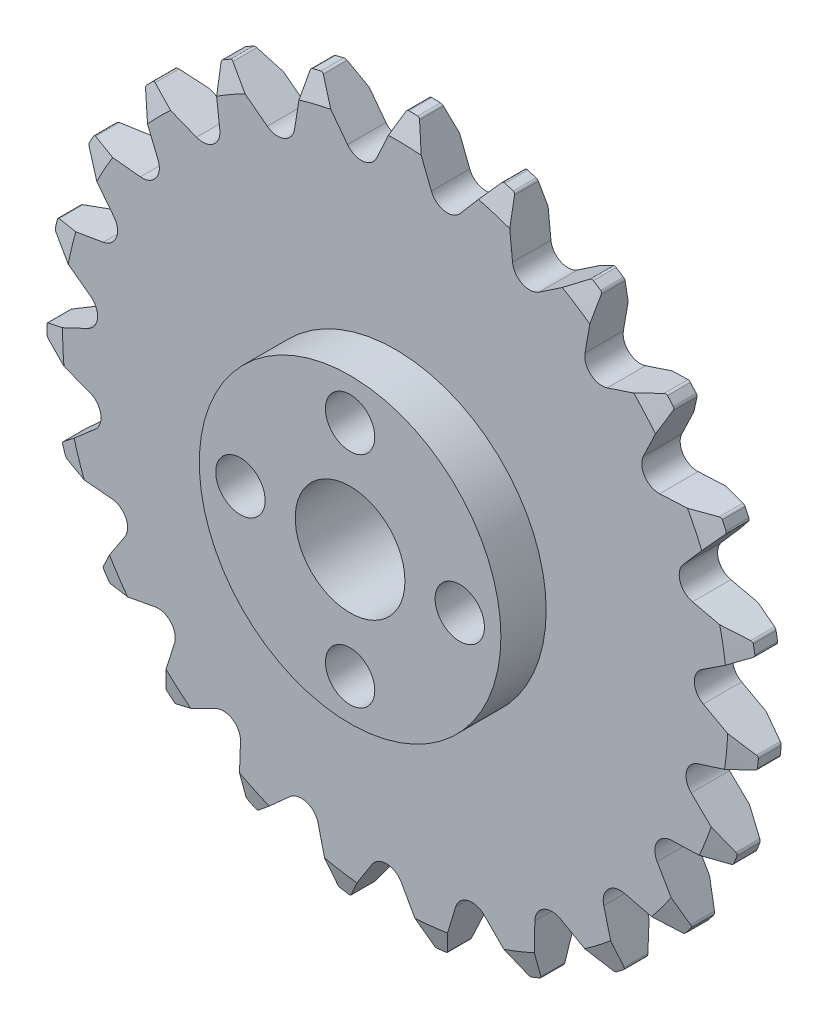
from build123d import *

# Parameters (mm, degrees)
SKETCH1_W                  = 26
SKETCH1_H                  = 2.7999944
CUT_EXTRUDE1_DEPTH         = 37.876008036
CUT_EXTRUDE2_DEPTH         = 37.876008036
CUT_EXTRUDE3_DEPTH         = 37.876008036
CUT_EXTRUDE4_DEPTH         = 37.876008036
CUT_EXTRUDE5_DEPTH         = 37.876008036
CUT_EXTRUDE6_DEPTH         = 37.876008036
CUT_EXTRUDE7_DEPTH         = 37.876008036
CUT_EXTRUDE8_DEPTH         = 37.876008036
CUT_EXTRUDE9_DEPTH         = 37.876008036
CUT_EXTRUDE10_DEPTH        = 37.876008036
CUT_EXTRUDE11_DEPTH        = 37.876008036
CUT_EXTRUDE12_DEPTH        = 37.876008036
CUT_EXTRUDE13_DEPTH        = 37.876008036
CUT_EXTRUDE14_DEPTH        = 37.876008036
CUT_EXTRUDE15_DEPTH        = 37.876008036
CUT_EXTRUDE16_DEPTH        = 37.871323245
CUT_EXTRUDE17_DEPTH        = 37.871323245
CUT_EXTRUDE18_DEPTH        = 37.871323245
CUT_EXTRUDE19_DEPTH        = 37.871323245
CUT_EXTRUDE20_DEPTH        = 37.871323245
CUT_EXTRUDE21_DEPTH        = 37.871323245
CUT_EXTRUDE22_DEPTH        = 37.870167928
CUT_EXTRUDE23_DEPTH        = 37.870167928
SKETCH25_W                 = 11
SKETCH25_H                 = 3.302
F_8_0_8_DIAMETER_HOLE1_D   = 8
F_3_6_3_6_DIAMETER_HOLE1_D = 3.6
F_3_6_3_6_DIAMETER_HOLE2_D = 3.6
FILLET1_R                  = 0.2


with BuildPart() as part:
    # Sketch1 → Revolve1 (revolve)
    with BuildSketch(Plane(origin=(0, 0, 0), x_dir=(1, 0, 0), z_dir=(0, 1, 0))):
        with Locations((13, 1.3999972)):
            Rectangle(SKETCH1_W, SKETCH1_H)
    revolve(axis=Axis((0, 0, -2.7999944), (0, 0, 1)))

    # Sketch2 → Cut-Extrude1 (cut, through all)
    with BuildSketch(Plane(origin=(0, 0, -2.7999944), x_dir=(-1, 0, 0), z_dir=(0, 0, -1))):
        with BuildLine():
            Line((18.801313039, 17.958580902), (17.308486788, 14.31139503))
            ThreePointArc((17.308486788, 14.31139503), (17.465043178, 13.088273063), (18.595024492, 12.594634046))
            Line((18.595024492, 12.594634046), (22.514630462, 13.003515492))
            ThreePointArc((22.514630462, 13.003515492), (20.80600791, 15.591986238), (18.801313039, 17.958580902))
        make_face()
    extrude(amount=-CUT_EXTRUDE1_DEPTH, mode=Mode.SUBTRACT)

    # Sketch3 → Cut-Extrude2 (cut, through all)
    with BuildSketch(Plane(origin=(0, 0, -2.7999944), x_dir=(-1, 0, 0), z_dir=(0, 0, -1))):
        with BuildLine():
            Line((22.949276492, 12.220094456), (20.527809316, 9.110915831))
            ThreePointArc((20.527809316, 9.110915831), (20.348565813, 7.890912137), (21.303462141, 7.110713283))
            Line((21.303462141, 7.110713283), (25.188033384, 6.446935261))
            ThreePointArc((25.188033384, 6.446935261), (24.24113224, 9.400399338), (22.949276492, 12.220094456))
        make_face()
    extrude(amount=-CUT_EXTRUDE2_DEPTH, mode=Mode.SUBTRACT)

    # Sketch4 → Cut-Extrude3 (cut, through all)
    with BuildSketch(Plane(origin=(0, 0, -2.7999944), x_dir=(-1, 0, 0), z_dir=(0, 0, -1))):
        with BuildLine():
            Line((25.395197093, 5.575299507), (22.224678136, 3.234721685))
            ThreePointArc((22.224678136, 3.234721685), (21.72292841, 2.108318355), (22.431919461, 1.099423446))
            Line((22.431919461, 1.099423446), (25.993355097, -0.587784666))
            ThreePointArc((25.993355097, -0.587784666), (25.878402688, 2.511627823), (25.395197093, 5.575299507))
        make_face()
    extrude(amount=-CUT_EXTRUDE3_DEPTH, mode=Mode.SUBTRACT)

    # Sketch5 → Cut-Extrude4 (cut, through all)
    with BuildSketch(Plane(origin=(0, 0, -2.7999944), x_dir=(-1, 0, 0), z_dir=(0, 0, -1))):
        with BuildLine():
            Line((25.957672102, -1.482989902), (22.273244249, -2.881376971))
            ThreePointArc((22.273244249, -2.881376971), (21.486200783, -3.830639754), (21.896703933, -4.993405599))
            Line((21.896703933, -4.993405599), (24.870868574, -7.578911293))
            ThreePointArc((24.870868574, -7.578911293), (25.596390394, -4.563419638), (25.957672102, -1.482989902))
        make_face()
    extrude(amount=-CUT_EXTRUDE4_DEPTH, mode=Mode.SUBTRACT)

    # Sketch6 → Cut-Extrude5 (cut, through all)
    with BuildSketch(Plane(origin=(0, 0, -2.7999944), x_dir=(-1, 0, 0), z_dir=(0, 0, -1))):
        with BuildLine():
            Line((24.594985319, -8.431292733), (20.669905729, -8.783777078))
            ThreePointArc((20.669905729, -8.783777078), (19.655939936, -9.485496836), (19.737510045, -10.715896595))
            Line((19.737510045, -10.715896595), (21.903823506, -14.00794474))
            ThreePointArc((21.903823506, -14.00794474), (23.416010921, -11.30001914), (24.594985319, -8.431292733))
        make_face()
    extrude(amount=-CUT_EXTRUDE5_DEPTH, mode=Mode.SUBTRACT)

    # Sketch7 → Cut-Extrude6 (cut, through all)
    with BuildSketch(Plane(origin=(0, 0, -2.7999944), x_dir=(-1, 0, 0), z_dir=(0, 0, -1))):
        with BuildLine():
            Line((21.40820099, -14.754285153), (17.53357486, -14.034724622))
            ThreePointArc((17.53357486, -14.034724622), (16.367887944, -14.436858011), (16.11447533, -15.643638561))
            Line((16.11447533, -15.643638561), (17.312272051, -19.398073008))
            ThreePointArc((17.312272051, -19.398073008), (19.498973038, -17.198547917), (21.40820099, -14.754285153))
        make_face()
    extrude(amount=-CUT_EXTRUDE6_DEPTH, mode=Mode.SUBTRACT)

    # Sketch8 → Cut-Extrude7 (cut, through all)
    with BuildSketch(Plane(origin=(0, 0, -2.7999944), x_dir=(-1, 0, 0), z_dir=(0, 0, -1))):
        with BuildLine():
            Line((16.633668329, -19.98301974), (13.096858955, -18.244780846))
            ThreePointArc((13.096858955, -18.244780846), (11.865904582, -18.317503472), (11.296303699, -19.411163421))
            Line((11.296303699, -19.411163421), (11.436748577, -23.349534942))
            ThreePointArc((11.436748577, -23.349534942), (14.135785527, -21.821539073), (16.633668329, -19.98301974))
        make_face()
    extrude(amount=-CUT_EXTRUDE7_DEPTH, mode=Mode.SUBTRACT)

    # Sketch9 → Cut-Extrude8 (cut, through all)
    with BuildSketch(Plane(origin=(0, 0, -2.7999944), x_dir=(-1, 0, 0), z_dir=(0, 0, -1))):
        with BuildLine():
            Line((10.625492582, -23.729705169), (7.688808935, -21.101705139))
            ThreePointArc((7.688808935, -21.101705139), (6.48388136, -20.839623497), (5.6403369, -21.739051089))
            Line((5.6403369, -21.739051089), (4.713013781, -25.569268685))
            ThreePointArc((4.713013781, -25.569268685), (7.724211471, -24.826126503), (10.625492582, -23.729705169))
        make_face()
    extrude(amount=-CUT_EXTRUDE8_DEPTH, mode=Mode.SUBTRACT)

    # Sketch10 → Cut-Extrude9 (cut, through all)
    with BuildSketch(Plane(origin=(0, 0, -2.7999944), x_dir=(-1, 0, 0), z_dir=(0, 0, -1))):
        with BuildLine():
            Line((3.829272659, -25.716466921), (1.71051513, -22.393612495))
            ThreePointArc((1.71051513, -22.393612495), (0.620978318, -21.816163983), (-0.433947885, -22.454652788))
            Line((-0.433947885, -22.454652788), (-2.360263687, -25.892646742))
            ThreePointArc((-2.360263687, -25.892646742), (0.739767985, -25.989473702), (3.829272659, -25.716466921))
        make_face()
    extrude(amount=-CUT_EXTRUDE9_DEPTH, mode=Mode.SUBTRACT)

    # Sketch11 → Cut-Extrude10 (cut, through all)
    with BuildSketch(Plane(origin=(0, 0, -2.7999944), x_dir=(-1, 0, 0), z_dir=(0, 0, -1))):
        with BuildLine():
            Line((-3.250946899, -25.795955967), (-4.394639757, -22.024688057))
            ThreePointArc((-4.394639757, -22.024688057), (-5.287979844, -21.174699388), (-6.47604874, -21.504895613))
            Line((-6.47604874, -21.504895613), (-9.258491195, -24.295685642))
            ThreePointArc((-9.258491195, -24.295685642), (-6.299540707, -25.225300531), (-3.250946899, -25.795955967))
        make_face()
    extrude(amount=-CUT_EXTRUDE10_DEPTH, mode=Mode.SUBTRACT)

    # Sketch12 → Cut-Extrude11 (cut, through all)
    with BuildSketch(Plane(origin=(0, 0, -2.7999944), x_dir=(-1, 0, 0), z_dir=(0, 0, -1))):
        with BuildLine():
            Line((-10.090058599, -23.962276968), (-10.173864317, -20.022293262))
            ThreePointArc((-10.173864317, -20.022293262), (-10.804752732, -18.962804207), (-12.037850686, -18.960218709))
            Line((-12.037850686, -18.960218709), (-15.470058766, -20.896824682))
            ThreePointArc((-15.470058766, -20.896824682), (-12.871641284, -22.590282217), (-10.090058599, -23.962276968))
        make_face()
    extrude(amount=-CUT_EXTRUDE11_DEPTH, mode=Mode.SUBTRACT)

    # Sketch13 → Cut-Extrude12 (cut, through all)
    with BuildSketch(Plane(origin=(0, 0, -2.7999944), x_dir=(-1, 0, 0), z_dir=(0, 0, -1))):
        with BuildLine():
            Line((-16.18083681, -20.351425506), (-15.198539903, -16.534936571))
            ThreePointArc((-15.198539903, -16.534936571), (-15.520186538, -15.344524588), (-16.706860316, -15.00934912))
            Line((-16.706860316, -15.00934912), (-20.534282848, -15.948141832))
            ThreePointArc((-20.534282848, -15.948141832), (-18.489111111, -18.279846015), (-16.18083681, -20.351425506))
        make_face()
    extrude(amount=-CUT_EXTRUDE12_DEPTH, mode=Mode.SUBTRACT)

    # Sketch14 → Cut-Extrude13 (cut, through all)
    with BuildSketch(Plane(origin=(0, 0, -2.7999944), x_dir=(-1, 0, 0), z_dir=(0, 0, -1))):
        with BuildLine():
            Line((-21.071556378, -15.231201916), (-19.096009313, -11.821259277))
            ThreePointArc((-19.096009313, -11.821259277), (-19.084559109, -10.588211776), (-20.136798545, -9.94530477))
            Line((-20.136798545, -9.94530477), (-24.07557311, -9.816658261))
            ThreePointArc((-24.07557311, -9.816658261), (-22.735328148, -12.613677259), (-21.071556378, -15.231201916))
        make_face()
    extrude(amount=-CUT_EXTRUDE13_DEPTH, mode=Mode.SUBTRACT)

    # Sketch15 → Cut-Extrude14 (cut, through all)
    with BuildSketch(Plane(origin=(0, 0, -2.7999944), x_dir=(-1, 0, 0), z_dir=(0, 0, -1))):
        with BuildLine():
            Line((-24.399495006, -8.981349757), (-21.577215071, -6.230853262))
            ThreePointArc((-21.577215071, -6.230853262), (-21.233517237, -5.046619734), (-22.073282546, -4.143662662))
            Line((-22.073282546, -4.143662662), (-25.831288253, -2.957118055))
            ThreePointArc((-25.831288253, -2.957118055), (-25.295369904, -6.012009764), (-24.399495006, -8.981349757))
        make_face()
    extrude(amount=-CUT_EXTRUDE14_DEPTH, mode=Mode.SUBTRACT)

    # Sketch16 → Cut-Extrude15 (cut, through all)
    with BuildSketch(Plane(origin=(0, 0, -2.7999944), x_dir=(-1, 0, 0), z_dir=(0, 0, -1))):
        with BuildLine():
            Line((-25.917834709, -2.065391975), (-22.458137497, -0.178333364))
            ThreePointArc((-22.458137497, -0.178333364), (-21.807682528, 0.869257006), (-22.372692159, 1.965295949))
            Line((-22.372692159, 1.965295949), (-25.671214916, 4.12173807))
            ThreePointArc((-25.671214916, 4.12173807), (-25.979369793, 1.035540992), (-25.917834709, -2.065391975))
        make_face()
    extrude(amount=-CUT_EXTRUDE15_DEPTH, mode=Mode.SUBTRACT)

    # Sketch17 → Cut-Extrude16 (cut, through all)
    with BuildSketch(Plane(origin=(0, 0, -2.7999944), x_dir=(-1, 0, 0), z_dir=(0, 0, -1))):
        with BuildLine():
            Line((-25.513967178, 5.003746482), (-21.673442603, 5.887412704))
            ThreePointArc((-21.673442603, 5.887412704), (-20.76447177, 6.720664931), (-21.012821543, 7.928497551))
            Line((-21.012821543, 7.928497551), (-23.607225007, 10.894903738))
            ThreePointArc((-23.607225007, 10.894903738), (-24.736598672, 8.00629041), (-25.513967178, 5.003746482))
        make_face()
    extrude(amount=-CUT_EXTRUDE16_DEPTH, mode=Mode.SUBTRACT)

    # Sketch18 → Cut-Extrude17 (cut, through all)
    with BuildSketch(Plane(origin=(0, 0, -2.7999944), x_dir=(-1, 0, 0), z_dir=(0, 0, -1))):
        with BuildLine():
            Line((-23.21784542, 11.701779953), (-19.281327621, 11.516516304))
            ThreePointArc((-19.281327621, 11.516516304), (-18.181255132, 12.073631883), (-18.09452608, 13.30367876))
            Line((-18.09452608, 13.30367876), (-19.792395215, 16.860044236))
            ThreePointArc((-19.792395215, 16.860044236), (-21.65922719, 14.383249894), (-23.21784542, 11.701779953))
        make_face()
    extrude(amount=-CUT_EXTRUDE17_DEPTH, mode=Mode.SUBTRACT)

    # Sketch19 → Cut-Extrude18 (cut, through all)
    with BuildSketch(Plane(origin=(0, 0, -2.7999944), x_dir=(-1, 0, 0), z_dir=(0, 0, -1))):
        with BuildLine():
            Line((-19.199762281, 17.531945937), (-15.459204775, 16.291492575))
            ThreePointArc((-15.459204775, 16.291492575), (-14.249617974, 16.531152791), (-13.834242395, 17.692186975))
            Line((-13.834242395, 17.692186975), (-14.509654015, 21.574752383))
            ThreePointArc((-14.509654015, 21.574752383), (-16.975489912, 19.693469533), (-19.199762281, 17.531945937))
        make_face()
    extrude(amount=-CUT_EXTRUDE18_DEPTH, mode=Mode.SUBTRACT)

    # Sketch20 → Cut-Extrude19 (cut, through all)
    with BuildSketch(Plane(origin=(0, 0, -2.7999944), x_dir=(-1, 0, 0), z_dir=(0, 0, -1))):
        with BuildLine():
            Line((-13.757720608, 22.061847694), (-10.490543432, 19.85820337))
            ThreePointArc((-10.490543432, 19.85820337), (-9.261151839, 19.762633722), (-8.547936239, 20.768546619))
            Line((-8.547936239, 20.768546619), (-8.150798153, 24.689359843))
            ThreePointArc((-8.150798153, 24.689359843), (-11.032758204, 23.543114628), (-13.757720608, 22.061847694))
        make_face()
    extrude(amount=-CUT_EXTRUDE19_DEPTH, mode=Mode.SUBTRACT)

    # Sketch21 → Cut-Extrude20 (cut, through all)
    with BuildSketch(Plane(origin=(0, 0, -2.7999944), x_dir=(-1, 0, 0), z_dir=(0, 0, -1))):
        with BuildLine():
            Line((-7.295331734, 24.955523134), (-4.743846474, 21.952122067))
            ThreePointArc((-4.743846474, 21.952122067), (-3.585828439, 21.528410517), (-2.627668756, 22.30459817))
            Line((-2.627668756, 22.30459817), (-1.187434879, 25.972870431))
            ThreePointArc((-1.187434879, 25.972870431), (-4.271777292, 25.646674614), (-7.295331734, 24.955523134))
        make_face()
    extrude(amount=-CUT_EXTRUDE20_DEPTH, mode=Mode.SUBTRACT)

    # Sketch22 → Cut-Extrude21 (cut, through all)
    with BuildSketch(Plane(origin=(0, 0, -2.7999944), x_dir=(-1, 0, 0), z_dir=(0, 0, -1))):
        with BuildLine():
            Line((-0.29188148, 25.998361587), (1.354679875, 22.417952294))
            ThreePointArc((1.354679875, 22.417952294), (2.355439453, 21.697523591), (3.487480897, 22.186419711))
            Line((3.487480897, 22.186419711), (5.863995007, 25.330092036))
            ThreePointArc((5.863995007, 25.330092036), (2.806021799, 25.84813807), (-0.29188148, 25.998361587))
        make_face()
    extrude(amount=-CUT_EXTRUDE21_DEPTH, mode=Mode.SUBTRACT)

    # Sketch23 → Cut-Extrude22 (cut, through all)
    with BuildSketch(Plane(origin=(0, 0, -2.7999944), x_dir=(-1, 0, 0), z_dir=(0, 0, -1))):
        with BuildLine():
            Line((6.733216289, 25.113020495), (7.352735815, 21.221145554))
            ThreePointArc((7.352735815, 21.221145554), (8.122015175, 20.257430599), (9.343980047, 20.422775999))
            Line((9.343980047, 20.422775999), (12.48051921, 22.808696593))
            ThreePointArc((12.48051921, 22.808696593), (9.675711091, 24.132563372), (6.733216289, 25.113020495))
        make_face()
    extrude(amount=-CUT_EXTRUDE22_DEPTH, mode=Mode.SUBTRACT)

    # Sketch24 → Cut-Extrude23 (cut, through all)
    with BuildSketch(Plane(origin=(0, 0, -2.7999944), x_dir=(-1, 0, 0), z_dir=(0, 0, -1))):
        with BuildLine():
            Line((13.258942208, 22.365161558), (12.805472976, 18.45046353))
            ThreePointArc((12.805472976, 18.45046353), (13.286218188, 17.314936652), (14.507478942, 17.144468418))
            Line((14.507478942, 17.144468418), (18.171420397, 18.595684466))
            ThreePointArc((18.171420397, 18.595684466), (15.827797154, 20.627186848), (13.258942208, 22.365161558))
        make_face()
    extrude(amount=-CUT_EXTRUDE23_DEPTH, mode=Mode.SUBTRACT)

    # Sketch25 → Revolve2 (revolve)
    with BuildSketch(Plane(origin=(0, 0, 0), x_dir=(1, 0, 0), z_dir=(0, 1, 0))):
        with Locations((5.5, -1.651)):
            Rectangle(SKETCH25_W, SKETCH25_H)
    revolve(axis=Axis((0, 0, 0), (0, 0, 1)))

    # Ø8.0 (8) Diameter Hole1 (through all)
    with Locations(Plane.XY.offset(3.302)):
        with Locations((0, 0)):
            Hole(F_8_0_8_DIAMETER_HOLE1_D / 2)

    # Ø3.6 (3.6) Diameter Hole1 (through all)
    with Locations(Plane.XY.offset(3.302)):
        with Locations((0, 8), (-8, 0), (0, -8)):
            Hole(F_3_6_3_6_DIAMETER_HOLE1_D / 2)

    # Ø3.6 (3.6) Diameter Hole2 (through all)
    with Locations(Plane(origin=(0, 0, -2.7999944), x_dir=(-1, 0, 0), z_dir=(0, 0, -1))):
        with Locations((-8, 0)):
            Hole(F_3_6_3_6_DIAMETER_HOLE2_D / 2)

    # Fillet1
    fillet1_edges = [part.edges().sort_by_distance(p)[0] for p in [
        (25.831288253, -2.957118055, -1.3999972),
        (25.917834709, -2.065391975, -1.3999972),
        (9.258491195, -24.295685642, -1.3999972),
        (10.090058599, -23.962276968, -1.3999972),
        (14.509654015, 21.574752383, -1.3999972),
        (13.757720608, 22.061847694, -1.3999972),
        (-13.258942208, 22.365161558, -1.3999972),
        (-12.48051921, 22.808696593, -1.3999972),
        (20.534282848, -15.948141832, -1.3999972),
        (21.071556378, -15.231201916, -1.3999972),
        (-18.801313039, 17.958580902, -1.3999972),
        (-18.171420397, 18.595684466, -1.3999972),
        (23.607225007, 10.894903738, -1.3999972),
        (23.21784542, 11.701779953, -1.3999972),
        (1.187434879, 25.972870431, -1.3999972),
        (0.29188148, 25.998361587, -1.3999972),
        (-22.949276492, 12.220094456, -1.3999972),
        (-22.514630462, 13.003515492, -1.3999972),
        (15.470058766, -20.896824682, -1.3999972),
        (16.18083681, -20.351425506, -1.3999972),
        (24.07557311, -9.816658261, -1.3999972),
        (24.399495006, -8.981349757, -1.3999972),
        (-25.395197093, 5.575299507, -1.3999972),
        (-25.188033384, 6.446935261, -1.3999972),
        (25.671214916, 4.12173807, -1.3999972),
        (25.513967178, 5.003746482, -1.3999972),
        (19.792395215, 16.860044236, -1.3999972),
        (19.199762281, 17.531945937, -1.3999972),
        (-25.957672102, -1.482989902, -1.3999972),
        (-25.993355097, -0.587784666, -1.3999972),
        (8.150798153, 24.689359843, -1.3999972),
        (7.295331734, 24.955523134, -1.3999972),
        (-5.863995007, 25.330092036, -1.3999972),
        (-6.733216289, 25.113020495, -1.3999972),
        (-24.594985319, -8.431292733, -1.3999972),
        (-24.870868574, -7.578911293, -1.3999972),
        (-21.40820099, -14.754285153, -1.3999972),
        (-21.903823506, -14.00794474, -1.3999972),
        (-16.633668329, -19.98301974, -1.3999972),
        (-17.312272051, -19.398073008, -1.3999972),
        (-10.625492582, -23.729705169, -1.3999972),
        (-11.436748577, -23.349534942, -1.3999972),
        (-3.829272659, -25.716466921, -1.3999972),
        (-4.713013781, -25.569268685, -1.3999972),
        (3.250946899, -25.795955967, -1.3999972),
        (2.360263687, -25.892646742, -1.3999972),
    ]]
    fillet(fillet1_edges, radius=FILLET1_R)

    # Sketch32 → Cut-Revolve1 (revolve, cut)
    with BuildSketch(Plane(origin=(0, 0, 0), x_dir=(0, 0, -1), z_dir=(1, 0, 0))):
        Polygon((0, 24.2697), (0, 26.0477), (0.5842, 26.0477), align=None)
        Polygon((2.2157944, 26.0477), (2.7999944, 24.2697), (2.7999944, 26.0477), align=None)
    revolve(axis=Axis((0, 0, 0), (0, 0, -1)), mode=Mode.SUBTRACT)


solid = part.part
